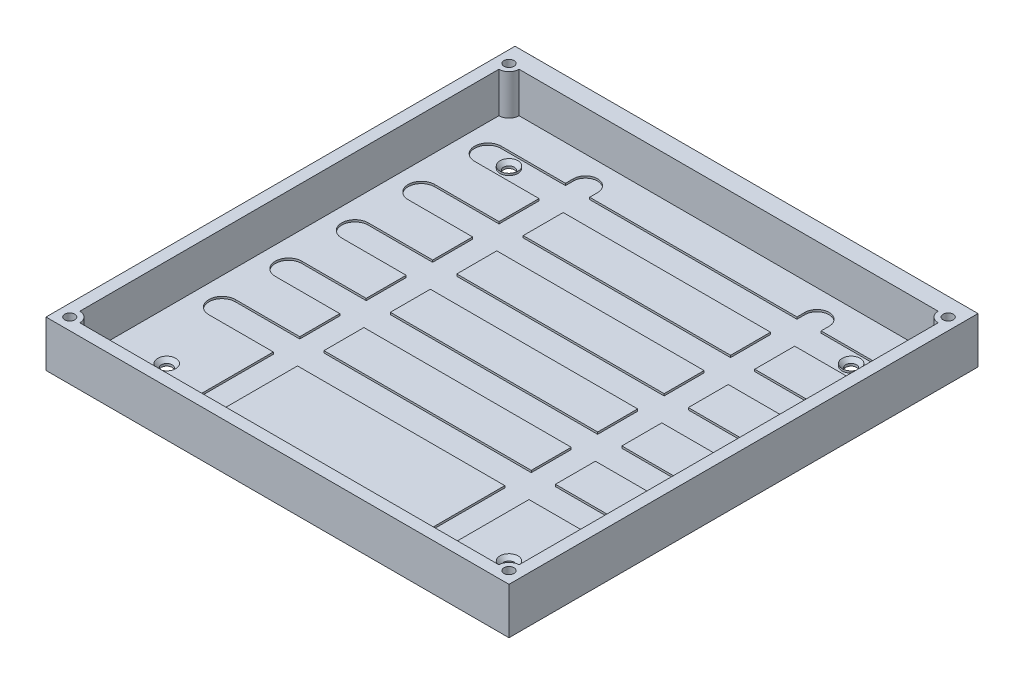
from build123d import *

# Parameters (mm, degrees)
CROQUIS1_W                                   = 230
CROQUIS1_H                                   = 233
CROQUIS1_R                                   = 2.65
SALIENTE_EXTRUIR1_DEPTH                      = 3
REFRENTADO_PARA_TORNILLO_TAP_N_CON_C_2_COUNT = 2
REFRENTADO_PARA_TORNILLO_TAP_N_CON_C_2_PITCH = 170
REFRENTADO_PARA_TORNILLO_TAP_N_CON_C_3_COUNT = 2
REFRENTADO_PARA_TORNILLO_TAP_N_CON_C_3_PITCH = 170
REFRENTADO_PARA_TORNILLO_TAP_N_CON_C_4_COUNT = 2
REFRENTADO_PARA_TORNILLO_TAP_N_CON_C_4_PITCH = 240.416305603
CROQUIS4_W                                   = 218.200156166
CROQUIS4_H                                   = 218.200156166
SALIENTE_EXTRUIR2_DEPTH                      = 20
CROQUIS5_R                                   = 5
SALIENTE_EXTRUIR3_DEPTH                      = 20
CROQUIS6_R                                   = 2.5
CORTAR_EXTRUIR1_DEPTH                        = 20
CORTAR_EXTRUIR2_DEPTH                        = 1
CORTAR_EXTRUIR3_START                        = -1
CORTAR_EXTRUIR3_OUTLINE_R                    = 4.48
CORTAR_EXTRUIR3_OUTLINE_W                    = 103
CORTAR_EXTRUIR3_OUTLINE_H                    = 13.137529202
CORTAR_EXTRUIR3_OUTLINE_H_2                  = 13.137529203
CORTAR_EXTRUIR3_DEPTH                        = 1


# Read off the part's stored shape, not the designer's step: Cortar-Extruir3
with BuildPart() as part:
    # Croquis1 → Saliente-Extruir1 (new body)
    with BuildSketch(Plane(origin=(0, 0, 0), x_dir=(1, 0, 0), z_dir=(0, 1, 0))):
        with Locations((0, 1.5)):
            Rectangle(CROQUIS1_W, CROQUIS1_H)
        with Locations(Location((-85, 85, 0), (0, 0, 270))):
            Circle(CROQUIS1_R, mode=Mode.SUBTRACT)
        with Locations(Location((-85, -85, 0), (0, 0, 270))):
            Circle(CROQUIS1_R, mode=Mode.SUBTRACT)
        with Locations(Location((85, -85, 0), (0, 0, 270))):
            Circle(CROQUIS1_R, mode=Mode.SUBTRACT)
        with Locations(Location((85, 85, 0), (0, 0, 270))):
            Circle(CROQUIS1_R, mode=Mode.SUBTRACT)
    extrude(amount=SALIENTE_EXTRUIR1_DEPTH)

    # Croquis3 → Refrentado para tornillo tapón con cabeza plana de clavija de M41 (revolve, cut)
    with BuildSketch(Plane(origin=(-85, 3, -85), x_dir=(0, 0, 1), z_dir=(1, 0, 0))):
        Polygon((0, 0), (0, 3), (2.25, 3), (2.25, 2.23), (4.48, 0), align=None)
    refrentado_para_tornillo_tap_n_con_cabez = revolve(axis=Axis((-85, 9.35, -85), (0, -1, 0)), mode=Mode.SUBTRACT)

    # Refrentado para tornillo tap_n con c 2: Refrentado para tornillo tapón con cabeza plana de clavija de M41 ×2
    with Locations(*[(i * REFRENTADO_PARA_TORNILLO_TAP_N_CON_C_2_PITCH, 0, 0) for i in range(1, REFRENTADO_PARA_TORNILLO_TAP_N_CON_C_2_COUNT)]):
        add(refrentado_para_tornillo_tap_n_con_cabez, mode=Mode.SUBTRACT)

    # Refrentado para tornillo tap_n con c 3: Refrentado para tornillo tapón con cabeza plana de clavija de M41 ×2
    with Locations(*[(0, 0, i * REFRENTADO_PARA_TORNILLO_TAP_N_CON_C_3_PITCH) for i in range(1, REFRENTADO_PARA_TORNILLO_TAP_N_CON_C_3_COUNT)]):
        add(refrentado_para_tornillo_tap_n_con_cabez, mode=Mode.SUBTRACT)

    # Refrentado para tornillo tap_n con c 4: Refrentado para tornillo tapón con cabeza plana de clavija de M41 ×2
    with Locations(*[Vector(0.7071067811865476, 0, 0.7071067811865475) * (i * REFRENTADO_PARA_TORNILLO_TAP_N_CON_C_4_PITCH) for i in range(1, REFRENTADO_PARA_TORNILLO_TAP_N_CON_C_4_COUNT)]):
        add(refrentado_para_tornillo_tap_n_con_cabez, mode=Mode.SUBTRACT)

    # Croquis4 → Saliente-Extruir2 (add)
    with BuildSketch(Plane(origin=(0, 3, 0), x_dir=(1, 0, 0), z_dir=(0, 1, 0))):
        Polygon((-115, 115), (-115, -115), (115, -115), (115, 115), (115, 118), (-115, 118), align=None)
        Rectangle(CROQUIS4_W, CROQUIS4_H, mode=Mode.SUBTRACT)
    extrude(amount=SALIENTE_EXTRUIR2_DEPTH)

    # Croquis5 → Saliente-Extruir3 (add)
    with BuildSketch(Plane(origin=(0, 23, 0), x_dir=(1, 0, 0), z_dir=(0, 1, 0))):
        with Locations((-109.100078083, 109.100078083)):
            Circle(CROQUIS5_R)
        with Locations((109.100078083, 109.100078083)):
            Circle(CROQUIS5_R)
        with Locations((109.100078083, -109.100078083)):
            Circle(CROQUIS5_R)
        with Locations((-109.100078083, -109.100078083)):
            Circle(CROQUIS5_R)
    extrude(amount=-SALIENTE_EXTRUIR3_DEPTH)

    # Croquis6 → Cortar-Extruir1 (cut)
    with BuildSketch(Plane(origin=(0, 23, 0), x_dir=(1, 0, 0), z_dir=(0, 1, 0))):
        with Locations(Location((-109.100078083, 109.100078083, 0), (0, 0, 270))):
            Circle(CROQUIS6_R)
        with Locations(Location((109.100078083, 109.100078083, 0), (0, 0, 90))):
            Circle(CROQUIS6_R)
        with Locations(Location((109.100078083, -109.100078083, 0), (0, 0, 270))):
            Circle(CROQUIS6_R)
        with Locations(Location((-109.100078083, -109.100078083, 0), (0, 0, 90))):
            Circle(CROQUIS6_R)
    extrude(amount=-CORTAR_EXTRUIR1_DEPTH, mode=Mode.SUBTRACT)

    # Croquis8 → Cortar-Extruir2 (cut)
    with BuildSketch(Plane(origin=(0, 3, 0), x_dir=(1, 0, 0), z_dir=(0, 1, 0))):
        with BuildLine():
            Line((-51.5, 95.5), (-51.5, -90))
            ThreePointArc((-51.5, -90), (-57.5, -96), (-63.5, -90))
            Line((-63.5, -90), (-63.5, 95.5))
            ThreePointArc((-63.5, 95.5), (-57.5, 101.5), (-51.5, 95.5))
        make_face()
        with BuildLine():
            Line((51.5, 95.5), (51.5, -90))
            ThreePointArc((51.5, -90), (57.5, -96), (63.5, -90))
            Line((63.5, -90), (63.5, 95.5))
            ThreePointArc((63.5, 95.5), (57.5, 101.5), (51.5, 95.5))
        make_face()
    extrude(amount=-CORTAR_EXTRUIR2_DEPTH, mode=Mode.SUBTRACT)

    # Cortar-Extruir3 outline → Cortar-Extruir3 (cut)
    # profile 1 of 15: a face of its own
    with BuildSketch(Plane(origin=(0, 3, 0), x_dir=(1, 0, 0), z_dir=(0, 1, 0)).offset(CORTAR_EXTRUIR3_START)):
        with BuildLine():
            ThreePointArc((-95.500196079, -40.431229574), (-102.06896068, -46.999994175), (-95.500196079, -53.568758776))
            Line((-95.500196079, -53.568758776), (-63.5, -53.568758776))
            Line((-63.5, -53.568758776), (-63.5, -40.431229574))
            Line((-63.5, -40.431229574), (-95.500196079, -40.431229574))
        make_face()
    # profile 2 of 15: a face of its own
    with BuildSketch(Plane(origin=(0, 3, 0), x_dir=(1, 0, 0), z_dir=(0, 1, 0)).offset(CORTAR_EXTRUIR3_START)):
        with BuildLine():
            Line((-95.509999989, 78.431242715), (-63.5, 78.431235399))
            Line((-63.5, 78.431235399), (-63.5, 91.568764601))
            Line((-63.5, 91.568764601), (-95.509999989, 91.568757285))
            ThreePointArc((-95.509999989, 91.568757285), (-102.06896068, 85), (-95.509999989, 78.431242715))
        make_face()
        with Locations((-85, 85)):
            Circle(CORTAR_EXTRUIR3_OUTLINE_R, mode=Mode.SUBTRACT)
    # profile 3 of 15: a face of its own
    with BuildSketch(Plane(origin=(0, 3, 0), x_dir=(1, 0, 0), z_dir=(0, 1, 0)).offset(CORTAR_EXTRUIR3_START)):
        with BuildLine():
            Line((-95.509999989, 45.431244171), (-63.5, 45.431236855))
            Line((-63.5, 45.431236855), (-63.5, 58.568766057))
            Line((-63.5, 58.568766057), (-95.509999989, 58.568758741))
            ThreePointArc((-95.509999989, 58.568758741), (-102.06896068, 52.000001456), (-95.509999989, 45.431244171))
        make_face()
    # profile 4 of 15: a face of its own
    with BuildSketch(Plane(origin=(0, 3, 0), x_dir=(1, 0, 0), z_dir=(0, 1, 0)).offset(CORTAR_EXTRUIR3_START)):
        with BuildLine():
            Line((-95.509999989, 12.431245628), (-63.5, 12.431238311))
            Line((-63.5, 12.431238311), (-63.5, 25.568767514))
            Line((-63.5, 25.568767514), (-95.509999989, 25.568760198))
            ThreePointArc((-95.509999989, 25.568760198), (-102.06896068, 19.000002913), (-95.509999989, 12.431245628))
        make_face()
    # profile 5 of 15: a face of its own
    with BuildSketch(Plane(origin=(0, 3, 0), x_dir=(1, 0, 0), z_dir=(0, 1, 0)).offset(CORTAR_EXTRUIR3_START)):
        with BuildLine():
            Line((-95.509999989, -20.568752916), (-63.5, -20.568760232))
            Line((-63.5, -20.568760232), (-63.5, -7.43123103))
            Line((-63.5, -7.43123103), (-95.509999989, -7.431238346))
            ThreePointArc((-95.509999989, -7.431238346), (-102.06896068, -13.999995631), (-95.509999989, -20.568752916))
        make_face()
    # profile 6 of 15: a face of its own
    with BuildSketch(Plane(origin=(0, 3, 0), x_dir=(1, 0, 0), z_dir=(0, 1, 0)).offset(CORTAR_EXTRUIR3_START)):
        with Locations((0, -46.999994175)):
            Rectangle(CORTAR_EXTRUIR3_OUTLINE_W, CORTAR_EXTRUIR3_OUTLINE_H)
    # profile 7 of 15: a face of its own
    with BuildSketch(Plane(origin=(0, 3, 0), x_dir=(1, 0, 0), z_dir=(0, 1, 0)).offset(CORTAR_EXTRUIR3_START)):
        with Locations((0, -13.999995631)):
            Rectangle(CORTAR_EXTRUIR3_OUTLINE_W, CORTAR_EXTRUIR3_OUTLINE_H)
    # profile 8 of 15: a face of its own
    with BuildSketch(Plane(origin=(0, 3, 0), x_dir=(1, 0, 0), z_dir=(0, 1, 0)).offset(CORTAR_EXTRUIR3_START)):
        with Locations((0, 19.000002913)):
            Rectangle(CORTAR_EXTRUIR3_OUTLINE_W, CORTAR_EXTRUIR3_OUTLINE_H_2)
    # profile 9 of 15: a face of its own
    with BuildSketch(Plane(origin=(0, 3, 0), x_dir=(1, 0, 0), z_dir=(0, 1, 0)).offset(CORTAR_EXTRUIR3_START)):
        with Locations((0, 52.000001456)):
            Rectangle(CORTAR_EXTRUIR3_OUTLINE_W, CORTAR_EXTRUIR3_OUTLINE_H)
    # profile 10 of 15: a face of its own
    with BuildSketch(Plane(origin=(0, 3, 0), x_dir=(1, 0, 0), z_dir=(0, 1, 0)).offset(CORTAR_EXTRUIR3_START)):
        with Locations((0, 85)):
            Rectangle(CORTAR_EXTRUIR3_OUTLINE_W, CORTAR_EXTRUIR3_OUTLINE_H)
    # profile 11 of 15: a face of its own
    with BuildSketch(Plane(origin=(0, 3, 0), x_dir=(1, 0, 0), z_dir=(0, 1, 0)).offset(CORTAR_EXTRUIR3_START)):
        with BuildLine():
            Line((63.5, -40.431229574), (63.5, -53.568758776))
            Line((63.5, -53.568758776), (96.509803921, -53.568758776))
            ThreePointArc((96.509803921, -53.568758776), (103.078568522, -46.999994175), (96.509803921, -40.431229574))
            Line((96.509803921, -40.431229574), (63.5, -40.431229574))
        make_face()
    # profile 12 of 15: a face of its own
    with BuildSketch(Plane(origin=(0, 3, 0), x_dir=(1, 0, 0), z_dir=(0, 1, 0)).offset(CORTAR_EXTRUIR3_START)):
        with BuildLine():
            Line((63.5, 91.568764601), (63.5, 78.431235399))
            Line((63.5, 78.431235399), (96.50980391, 78.431242715))
            ThreePointArc((96.50980391, 78.431242715), (103.068764601, 85), (96.50980391, 91.568757285))
            Line((96.50980391, 91.568757285), (63.5, 91.568764601))
        make_face()
        with Locations((85, 85)):
            Circle(CORTAR_EXTRUIR3_OUTLINE_R, mode=Mode.SUBTRACT)
    # profile 13 of 15: a face of its own
    with BuildSketch(Plane(origin=(0, 3, 0), x_dir=(1, 0, 0), z_dir=(0, 1, 0)).offset(CORTAR_EXTRUIR3_START)):
        with BuildLine():
            Line((63.5, 58.568766057), (63.5, 45.431236855))
            Line((63.5, 45.431236855), (96.50980391, 45.431244171))
            ThreePointArc((96.50980391, 45.431244171), (103.068764601, 52.000001456), (96.50980391, 58.568758741))
            Line((96.50980391, 58.568758741), (63.5, 58.568766057))
        make_face()
    # profile 14 of 15: a face of its own
    with BuildSketch(Plane(origin=(0, 3, 0), x_dir=(1, 0, 0), z_dir=(0, 1, 0)).offset(CORTAR_EXTRUIR3_START)):
        with BuildLine():
            Line((63.5, 25.568767514), (63.5, 12.431238311))
            Line((63.5, 12.431238311), (96.50980391, 12.431245628))
            ThreePointArc((96.50980391, 12.431245628), (103.068764601, 19.000002913), (96.50980391, 25.568760198))
            Line((96.50980391, 25.568760198), (63.5, 25.568767514))
        make_face()
    # profile 15 of 15: a face of its own
    with BuildSketch(Plane(origin=(0, 3, 0), x_dir=(1, 0, 0), z_dir=(0, 1, 0)).offset(CORTAR_EXTRUIR3_START)):
        with BuildLine():
            Line((63.5, -7.43123103), (63.5, -20.568760232))
            Line((63.5, -20.568760232), (96.50980391, -20.568752916))
            ThreePointArc((96.50980391, -20.568752916), (103.068764601, -13.999995631), (96.50980391, -7.431238346))
            Line((96.50980391, -7.431238346), (63.5, -7.43123103))
        make_face()
    extrude(amount=CORTAR_EXTRUIR3_DEPTH, mode=Mode.SUBTRACT)


solid = part.part
